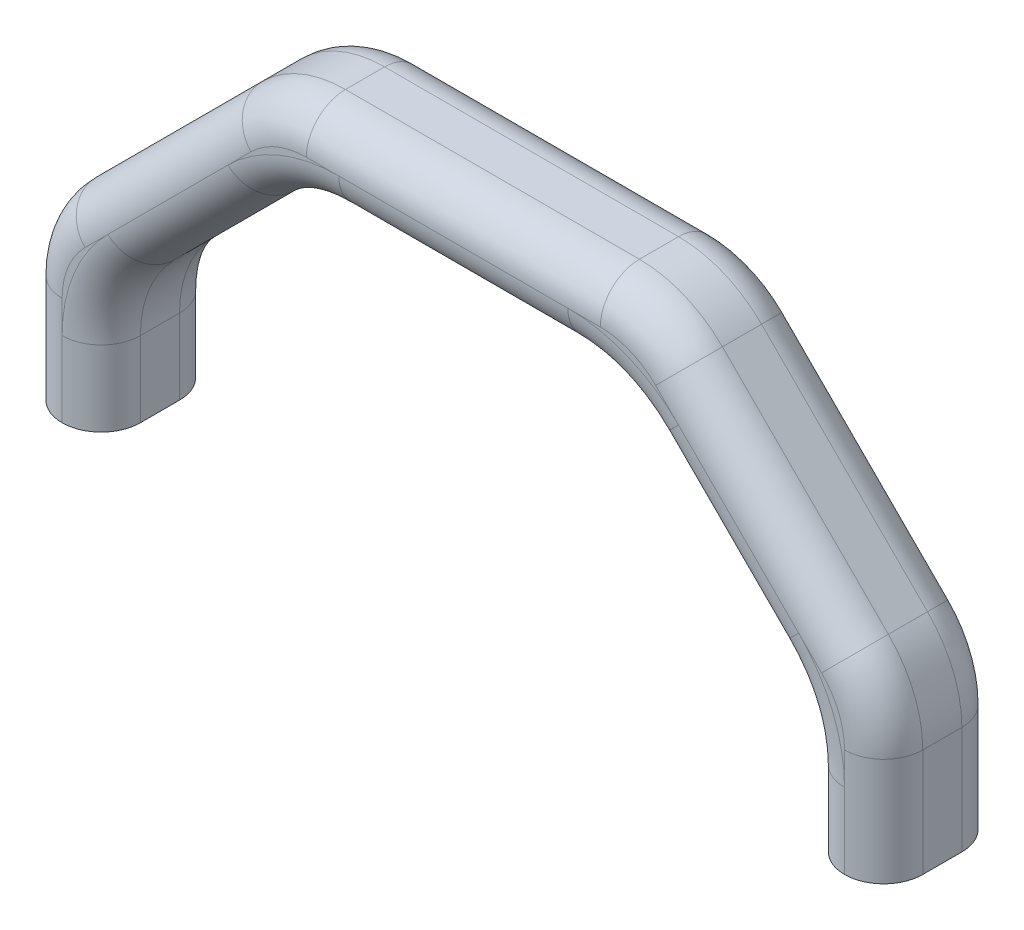
from build123d import *

# Parameters (mm, degrees)
BOSS_EXTRU_1_DEPTH                  = 15
CONG_4_R                            = 15
CONG_5_R                            = 5
DIAM_TRE_DU_PER_AGE_3_2_3_2_1_D     = 3.2
DIAM_TRE_DU_PER_AGE_3_2_3_2_1_DEPTH = 10
DIAM_TRE_DU_PER_AGE_3_2_3_2_1_TIP   = 0.96137699


with BuildPart() as part:
    # Esquisse1 → Boss.-Extru.1 (new body)
    with BuildSketch(Plane.XY):
        Polygon((100, 0), (110, 0), (110, 20), (80, 50), (30, 50), (0, 20), (0, 0), (10, 0), (10, 15.857864376), (34.142135624, 40), (75.857864376, 40), (100, 15.857864376), align=None)
    extrude(amount=BOSS_EXTRU_1_DEPTH)

    # Congé4
    cong_4_edges = [part.edges().sort_by_distance(p)[0] for p in [
        (0, 20, 7.5),
        (30, 50, 7.5),
        (80, 50, 7.5),
        (110, 20, 7.5),
        (100, 15.857864376, 7.5),
        (75.857864376, 40, 7.5),
        (34.142135624, 40, 7.5),
        (10, 15.857864376, 7.5),
    ]]
    fillet(cong_4_edges, radius=CONG_4_R)

    # Congé5
    cong_5_edges = [part.edges().sort_by_distance(p)[0] for p in [
        (100, 4.82233047, 0),
        (98.858192988, 15.384912426, 0),
        (87.928932188, 27.928932188, 0),
        (75.384912426, 38.858192988, 0),
        (55, 40, 0),
        (34.615087574, 38.858192988, 0),
        (22.071067812, 27.928932188, 0),
        (11.141807012, 15.384912426, 0),
        (10, 4.82233047, 0),
        (0, 6.893398282, 0),
        (1.141807012, 19.52704805, 0),
        (15, 35, 0),
        (30.47295195, 48.858192988, 0),
        (55, 50, 0),
        (79.52704805, 48.858192988, 0),
        (95, 35, 0),
        (108.858192988, 19.52704805, 0),
        (110, 6.893398282, 0),
        (110, 6.893398282, 15),
        (108.858192988, 19.52704805, 15),
        (95, 35, 15),
        (79.52704805, 48.858192988, 15),
        (0, 6.893398282, 15),
        (1.141807012, 19.52704805, 15),
        (15, 35, 15),
        (30.47295195, 48.858192988, 15),
        (10, 4.82233047, 15),
        (11.141807012, 15.384912426, 15),
        (22.071067812, 27.928932188, 15),
        (34.615087574, 38.858192988, 15),
        (55, 40, 15),
        (75.384912426, 38.858192988, 15),
        (100, 4.82233047, 15),
        (98.858192988, 15.384912426, 15),
        (55, 50, 15),
        (87.928932188, 27.928932188, 15),
    ]]
    fillet(cong_5_edges, radius=CONG_5_R - 0.0001)  # a hair under: the kernel refuses the full size

    # Diamètre du perçage Ø3.2 (3.2)1
    with Locations(Plane(origin=(0, 0, 0), x_dir=(-1, 0, 0), z_dir=(0, -1, 0))):
        with Locations((-105, -7.5), (-5, -7.5)):
            Hole(DIAM_TRE_DU_PER_AGE_3_2_3_2_1_D / 2, depth=DIAM_TRE_DU_PER_AGE_3_2_3_2_1_DEPTH)
            with Locations((0, 0, -(DIAM_TRE_DU_PER_AGE_3_2_3_2_1_DEPTH + DIAM_TRE_DU_PER_AGE_3_2_3_2_1_TIP / 2))):  # 118° drill point
                Cone(0, DIAM_TRE_DU_PER_AGE_3_2_3_2_1_D / 2, DIAM_TRE_DU_PER_AGE_3_2_3_2_1_TIP, mode=Mode.SUBTRACT)


solid = part.part
